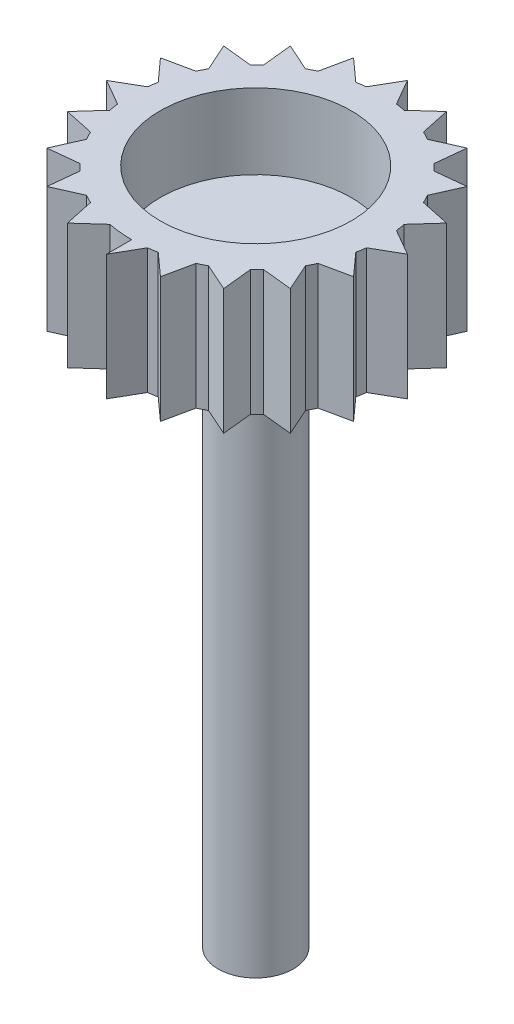
from build123d import *

# Parameters (mm, degrees)
BOSS_EXTRUDE2_DEPTH = 2.5
SKETCH5_R           = 1.905
CUT_EXTRUDE1_DEPTH  = 1.5
SKETCH6_R           = 0.75
BOSS_EXTRUDE3_DEPTH = 11


# Read off the part's stored shape, not the designer's step: Boss-Extrude2
with BuildPart() as part:
    # Boss-Extrude2 outline → Boss-Extrude2 (new body)
    with BuildSketch(Plane(origin=(0, 0, 0), x_dir=(1, 0, 0), z_dir=(0, 1, 0))):
        with BuildLine():
            ThreePointArc((-0.444105945, -2.466402753), (-0.203951755, -2.501641146), (0.038487797, -2.513424302))
            Line((0.038487797, -2.513424302), (0.038487797, -3.013424302))
            Line((0.038487797, -3.013424302), (0.337525902, -2.495475109))
            ThreePointArc((0.337525902, -2.495475109), (0.429573959, -2.482645153), (0.521081538, -2.466402753))
            Line((0.521081538, -2.466402753), (0.96553878, -2.866593851))
            Line((0.96553878, -2.866593851), (1.089885816, -2.28158704))
            ThreePointArc((1.089885816, -2.28158704), (1.173464046, -2.240940612), (1.255473747, -2.197215774))
            Line((1.255473747, -2.197215774), (1.801843553, -2.440475285))
            Line((1.801843553, -2.440475285), (1.739327566, -1.845675398))
            ThreePointArc((1.739327566, -1.845675398), (1.80625475, -1.781191255), (1.870738892, -1.714264071))
            Line((1.870738892, -1.714264071), (2.46553878, -1.776780059))
            Line((2.46553878, -1.776780059), (2.222279269, -1.230410253))
            ThreePointArc((2.222279269, -1.230410253), (2.266004107, -1.148400551), (2.306650534, -1.064822321))
            Line((2.306650534, -1.064822321), (2.891657345, -0.940475285))
            Line((2.891657345, -0.940475285), (2.491466248, -0.496018043))
            ThreePointArc((2.491466248, -0.496018043), (2.507708648, -0.404510464), (2.520538604, -0.312462408))
            Line((2.520538604, -0.312462408), (3.038487797, -0.013424302))
            Line((3.038487797, -0.013424302), (2.520538604, 0.285613804))
            ThreePointArc((2.520538604, 0.285613804), (2.507708648, 0.377661861), (2.491466248, 0.46916944))
            Line((2.491466248, 0.46916944), (2.891657345, 0.913626681))
            Line((2.891657345, 0.913626681), (2.306650534, 1.037973718))
            ThreePointArc((2.306650534, 1.037973718), (2.266004107, 1.121551948), (2.222279269, 1.203561649))
            Line((2.222279269, 1.203561649), (2.46553878, 1.749931455))
            Line((2.46553878, 1.749931455), (1.870738892, 1.687415468))
            ThreePointArc((1.870738892, 1.687415468), (1.80625475, 1.754342652), (1.739327566, 1.818826794))
            Line((1.739327566, 1.818826794), (1.801843553, 2.413626681))
            Line((1.801843553, 2.413626681), (1.255473747, 2.170367171))
            ThreePointArc((1.255473747, 2.170367171), (1.173464046, 2.214092009), (1.089885816, 2.254738436))
            Line((1.089885816, 2.254738436), (0.96553878, 2.839745247))
            Line((0.96553878, 2.839745247), (0.521081538, 2.439554149))
            ThreePointArc((0.521081538, 2.439554149), (0.429573959, 2.45579655), (0.337525902, 2.468626506))
            Line((0.337525902, 2.468626506), (0.038487797, 2.986575698))
            Line((0.038487797, 2.986575698), (-0.260550309, 2.468626506))
            ThreePointArc((-0.260550309, 2.468626506), (-0.352598366, 2.45579655), (-0.444105945, 2.439554149))
            Line((-0.444105945, 2.439554149), (-0.888563187, 2.839745247))
            Line((-0.888563187, 2.839745247), (-1.012910223, 2.254738436))
            ThreePointArc((-1.012910223, 2.254738436), (-1.096488453, 2.214092009), (-1.178498154, 2.170367171))
            Line((-1.178498154, 2.170367171), (-1.72486796, 2.413626681))
            Line((-1.72486796, 2.413626681), (-1.662351973, 1.818826794))
            ThreePointArc((-1.662351973, 1.818826794), (-1.729279156, 1.754342651), (-1.793763299, 1.687415468))
            Line((-1.793763299, 1.687415468), (-2.388563187, 1.749931455))
            Line((-2.388563187, 1.749931455), (-2.145303676, 1.203561649))
            ThreePointArc((-2.145303676, 1.203561649), (-2.189028514, 1.121551948), (-2.229674941, 1.037973718))
            Line((-2.229674941, 1.037973718), (-2.814681752, 0.913626681))
            Line((-2.814681752, 0.913626681), (-2.414490654, 0.46916944))
            ThreePointArc((-2.414490654, 0.46916944), (-2.430733055, 0.377661861), (-2.443563011, 0.285613804))
            Line((-2.443563011, 0.285613804), (-2.961512203, -0.013424302))
            Line((-2.961512203, -0.013424302), (-2.443563011, -0.312462408))
            ThreePointArc((-2.443563011, -0.312462408), (-2.430733055, -0.404510465), (-2.414490654, -0.496018043))
            Line((-2.414490654, -0.496018043), (-2.814681752, -0.940475285))
            Line((-2.814681752, -0.940475285), (-2.229674941, -1.064822321))
            ThreePointArc((-2.229674941, -1.064822321), (-2.189028514, -1.148400551), (-2.145303676, -1.230410253))
            Line((-2.145303676, -1.230410253), (-2.388563187, -1.776780059))
            Line((-2.388563187, -1.776780059), (-1.793763299, -1.714264071))
            ThreePointArc((-1.793763299, -1.714264071), (-1.729279156, -1.781191255), (-1.662351973, -1.845675398))
            Line((-1.662351973, -1.845675398), (-1.72486796, -2.440475285))
            Line((-1.72486796, -2.440475285), (-1.178498154, -2.197215774))
            ThreePointArc((-1.178498154, -2.197215774), (-1.096488453, -2.240940612), (-1.012910223, -2.28158704))
            Line((-1.012910223, -2.28158704), (-0.888563187, -2.866593851))
            Line((-0.888563187, -2.866593851), (-0.444105945, -2.466402753))
        make_face()
    extrude(amount=BOSS_EXTRUDE2_DEPTH)

    # Sketch5 → Cut-Extrude1 (cut)
    with BuildSketch(Plane(origin=(0, 2.5, 0), x_dir=(1, 0, 0), z_dir=(0, 1, 0))):
        with Locations(Location((0, 0, 0), (0, 0, 270))):
            Circle(SKETCH5_R)
    extrude(amount=-CUT_EXTRUDE1_DEPTH, mode=Mode.SUBTRACT)

    # Sketch6 → Boss-Extrude3 (add)
    with BuildSketch(Plane.XZ):
        with Locations(Location((0, 0, 0), (0, 0, 90))):
            Circle(SKETCH6_R)
    extrude(amount=BOSS_EXTRUDE3_DEPTH)


solid = part.part
